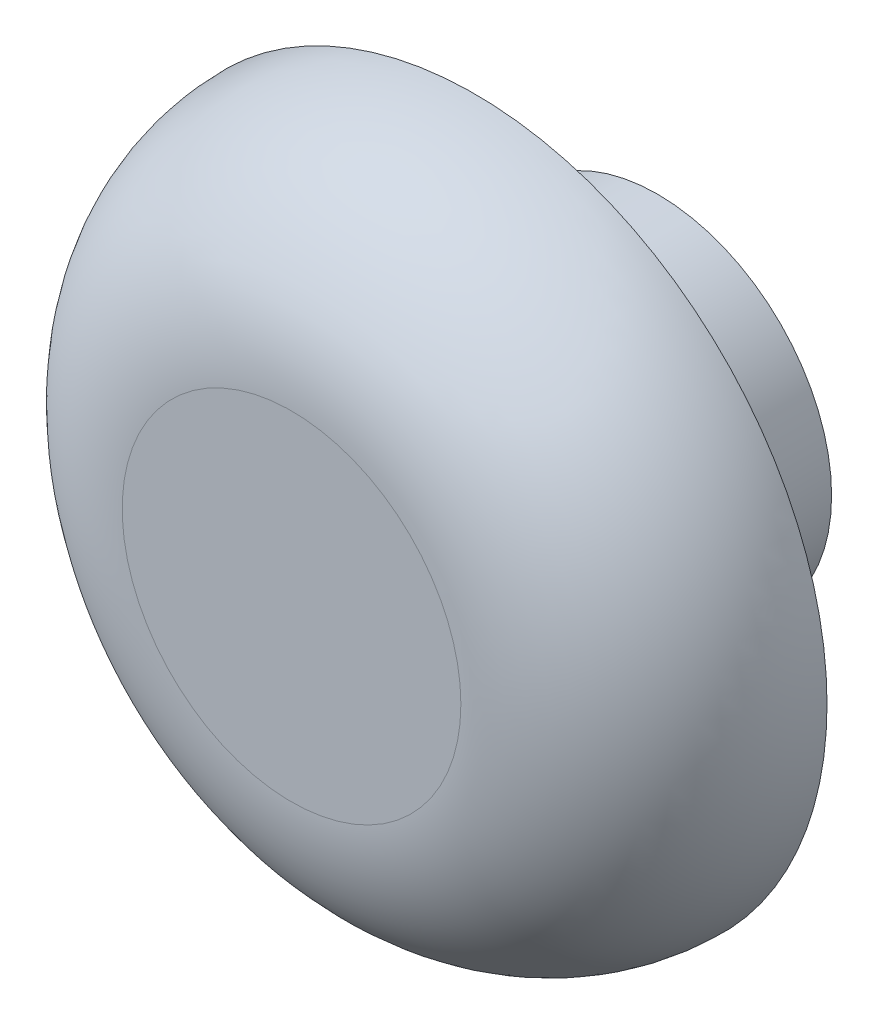
from build123d import *

# Parameters (mm, degrees)
SZKIC1_R                    = 1.9
DODANIE_WYCI_GNI_CIE1_DEPTH = 2
SZKIC3_R                    = 3.85
DODANIE_WYCI_GNI_CIE2_DEPTH = 2
ZAOKR_GLENIE1_R             = 2


with BuildPart() as part:
    # Szkic1 → Dodanie-wyciągnięcie1 (new body)
    with BuildSketch(Plane.XY):
        Circle(SZKIC1_R)
    extrude(amount=DODANIE_WYCI_GNI_CIE1_DEPTH)

    # Szkic3 → Dodanie-wyciągnięcie2 (add)
    with BuildSketch(Plane.XY.offset(2)):
        Circle(SZKIC3_R)
    extrude(amount=DODANIE_WYCI_GNI_CIE2_DEPTH)

    # Zaokrąglenie1
    zaokr_glenie1_edges = [part.edges().sort_by_distance(p)[0] for p in [
        (-3.85, 0, 4),
    ]]
    fillet(zaokr_glenie1_edges, radius=ZAOKR_GLENIE1_R - 0.0001)  # a hair under: the kernel refuses the full size


solid = part.part
